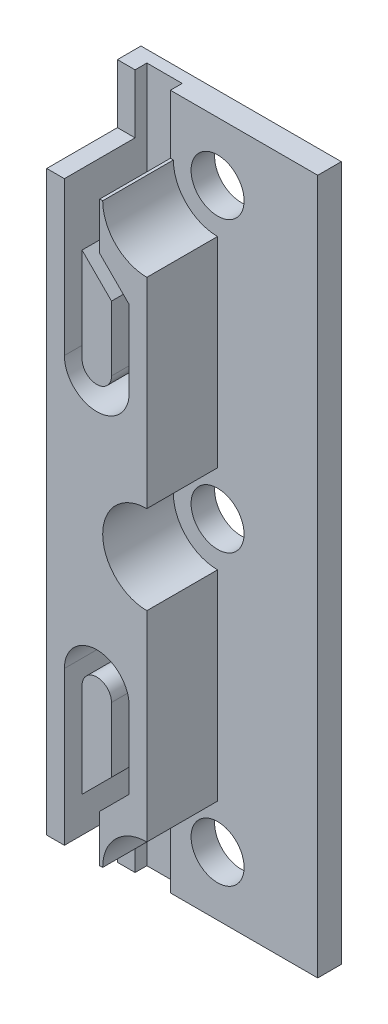
from build123d import *

# Parameters (mm, degrees)
ESQUISSE1_W             = 17
ESQUISSE1_H             = 59
BOSS_EXTRU_1_DEPTH      = 2
ESQUISSE2_W             = 8.5
ESQUISSE2_H             = 49
BOSS_EXTRU_2_DEPTH      = 6
ESQUISSE4_R             = 2.25
ENL_V_MAT_EXTRU_6_DEPTH = 27
ENL_V_MAT_EXTRU_7_DEPTH = 7
ESQUISSE5_R             = 3.75
ENL_V_MAT_EXTRU_8_DEPTH = 6


with BuildPart() as part:
    # Esquisse1 → Boss.-Extru.1 (new body)
    with BuildSketch(Plane.XY):
        with Locations((8.5, -29.5)):
            Rectangle(ESQUISSE1_W, ESQUISSE1_H)
    extrude(amount=BOSS_EXTRU_1_DEPTH)

    # Esquisse2 → Boss.-Extru.2 (add)
    with BuildSketch(Plane.XY.offset(2)):
        with Locations((4.25, -29.5)):
            Rectangle(ESQUISSE2_W, ESQUISSE2_H)
    extrude(amount=BOSS_EXTRU_2_DEPTH)

    # Esquisse4 → Enlèv. mat.-Extru.6 (cut)
    with BuildSketch(Plane.XY.offset(8)):
        with Locations((8.5, -54)):
            Circle(ESQUISSE4_R)
        with Locations((8.5, -29.5)):
            Circle(ESQUISSE4_R)
        with Locations((8.5, -5)):
            Circle(ESQUISSE4_R)
    extrude(amount=-ENL_V_MAT_EXTRU_6_DEPTH, mode=Mode.SUBTRACT)

    # Esquisse3 → Enlèv. mat.-Extru.7 (cut)
    with BuildSketch(Plane.XY.offset(8)):
        with BuildLine():
            Line((1.5, -41), (1.5, -61))
            Line((1.5, -61), (4.5, -61))
            Line((4.5, -61), (4.5, -50))
            Line((4.5, -50), (7, -47.5))
            Line((7, -47.5), (7, -41))
            ThreePointArc((7, -41), (4.25, -38.25), (1.5, -41))
        make_face()
        with BuildLine():
            Line((3, -49.5), (3, -41.5))
            ThreePointArc((3, -41.5), (4.25, -40.25), (5.5, -41.5))
            Line((5.5, -41.5), (5.5, -47))
            Line((5.5, -47), (3, -49.5))
        make_face(mode=Mode.SUBTRACT)
    enl_v_mat_extru_7 = extrude(amount=-ENL_V_MAT_EXTRU_7_DEPTH, mode=Mode.SUBTRACT)

    # Symétrie1: Enlèv. mat.-Extru.7 across plane
    add(enl_v_mat_extru_7.mirror(Plane.ZX.offset(-29.5)), mode=Mode.SUBTRACT)

    # Esquisse5 → Enlèv. mat.-Extru.8 (cut)
    with BuildSketch(Plane.XY.offset(8)):
        with Locations((8.5, -29.5)):
            Circle(ESQUISSE5_R)
        with Locations((8.5, -5)):
            Circle(ESQUISSE5_R)
        with Locations((8.5, -54)):
            Circle(ESQUISSE5_R)
    extrude(amount=-ENL_V_MAT_EXTRU_8_DEPTH, mode=Mode.SUBTRACT)


solid = part.part
